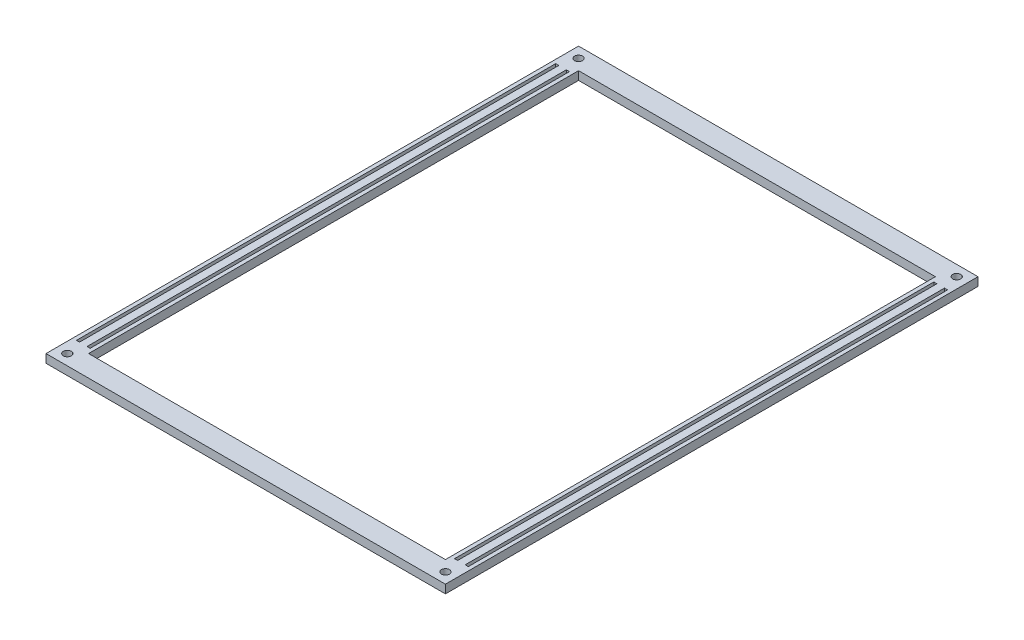
from build123d import *

# Parameters (mm, degrees)
SKETCH1_W          = 150
SKETCH1_H          = 200
SKETCH1_W_2        = 134
SKETCH1_H_2        = 184
MAINBODY_DEPTH     = 1.5875
SHEETLOCK_REACH    = 127.04
SKETCH2_W          = 1.17475
SKETCH2_H          = 180
SUPPORTHOLES_REACH = 127.04
SKETCH3_R          = 1.5


with BuildPart() as part:
    # Sketch1 → MainBody (new, symmetric)
    with BuildSketch(Plane(origin=(0, 0, 0), x_dir=(1, 0, 0), z_dir=(0, 1, 0))):
        Rectangle(SKETCH1_W, SKETCH1_H)
        Rectangle(SKETCH1_W_2, SKETCH1_H_2, mode=Mode.SUBTRACT)
    extrude(amount=MAINBODY_DEPTH, both=True)

    # Sketch2 → SheetLock (cut, up to next)
    with BuildSketch(Plane(origin=(0, 1.5875, 0), x_dir=(1, 0, 0), z_dir=(0, 1, 0)), mode=Mode.PRIVATE) as sheetlock_sk1:
        with Locations((-69, 0)):
            Rectangle(SKETCH2_W, SKETCH2_H)
    sheetlock_tool1 = extrude(sheetlock_sk1.sketch, amount=-SHEETLOCK_REACH, mode=Mode.PRIVATE) & part.part
    # Sketch2 → SheetLock (cut, up to next)
    with BuildSketch(Plane(origin=(0, 1.5875, 0), x_dir=(1, 0, 0), z_dir=(0, 1, 0)), mode=Mode.PRIVATE) as sheetlock_sk2:
        with Locations((-73, 0)):
            Rectangle(SKETCH2_W, SKETCH2_H)
    sheetlock_tool2 = extrude(sheetlock_sk2.sketch, amount=-SHEETLOCK_REACH, mode=Mode.PRIVATE) & part.part
    # Sketch2 → SheetLock (cut, up to next)
    with BuildSketch(Plane(origin=(0, 1.5875, 0), x_dir=(1, 0, 0), z_dir=(0, 1, 0)), mode=Mode.PRIVATE) as sheetlock_sk3:
        with Locations((69, 0)):
            Rectangle(SKETCH2_W, SKETCH2_H)
    sheetlock_tool3 = extrude(sheetlock_sk3.sketch, amount=-SHEETLOCK_REACH, mode=Mode.PRIVATE) & part.part
    # Sketch2 → SheetLock (cut, up to next)
    with BuildSketch(Plane(origin=(0, 1.5875, 0), x_dir=(1, 0, 0), z_dir=(0, 1, 0)), mode=Mode.PRIVATE) as sheetlock_sk4:
        with Locations((73, 0)):
            Rectangle(SKETCH2_W, SKETCH2_H)
    sheetlock_tool4 = extrude(sheetlock_sk4.sketch, amount=-SHEETLOCK_REACH, mode=Mode.PRIVATE) & part.part
    add(sheetlock_tool1.solids().sort_by_distance((-69, 1.5875, 0))[0], mode=Mode.SUBTRACT)
    add(sheetlock_tool2.solids().sort_by_distance((-73, 1.5875, 0))[0], mode=Mode.SUBTRACT)
    add(sheetlock_tool3.solids().sort_by_distance((69, 1.5875, 0))[0], mode=Mode.SUBTRACT)
    add(sheetlock_tool4.solids().sort_by_distance((73, 1.5875, 0))[0], mode=Mode.SUBTRACT)

    # Sketch3 → SupportHoles (cut, up to next)
    with BuildSketch(Plane(origin=(0, 1.5875, 0), x_dir=(1, 0, 0), z_dir=(0, 1, 0)), mode=Mode.PRIVATE) as supportholes_sk1:
        with Locations((-71, 96)):
            Circle(SKETCH3_R)
    supportholes_tool1 = extrude(supportholes_sk1.sketch, amount=-SUPPORTHOLES_REACH, mode=Mode.PRIVATE) & part.part
    # Sketch3 → SupportHoles (cut, up to next)
    with BuildSketch(Plane(origin=(0, 1.5875, 0), x_dir=(1, 0, 0), z_dir=(0, 1, 0)), mode=Mode.PRIVATE) as supportholes_sk2:
        with Locations((71, 96)):
            Circle(SKETCH3_R)
    supportholes_tool2 = extrude(supportholes_sk2.sketch, amount=-SUPPORTHOLES_REACH, mode=Mode.PRIVATE) & part.part
    # Sketch3 → SupportHoles (cut, up to next)
    with BuildSketch(Plane(origin=(0, 1.5875, 0), x_dir=(1, 0, 0), z_dir=(0, 1, 0)), mode=Mode.PRIVATE) as supportholes_sk3:
        with Locations((71, -96)):
            Circle(SKETCH3_R)
    supportholes_tool3 = extrude(supportholes_sk3.sketch, amount=-SUPPORTHOLES_REACH, mode=Mode.PRIVATE) & part.part
    # Sketch3 → SupportHoles (cut, up to next)
    with BuildSketch(Plane(origin=(0, 1.5875, 0), x_dir=(1, 0, 0), z_dir=(0, 1, 0)), mode=Mode.PRIVATE) as supportholes_sk4:
        with Locations((-71, -96)):
            Circle(SKETCH3_R)
    supportholes_tool4 = extrude(supportholes_sk4.sketch, amount=-SUPPORTHOLES_REACH, mode=Mode.PRIVATE) & part.part
    add(supportholes_tool1.solids().sort_by_distance((-71, 1.5875, -96))[0], mode=Mode.SUBTRACT)
    add(supportholes_tool2.solids().sort_by_distance((71, 1.5875, -96))[0], mode=Mode.SUBTRACT)
    add(supportholes_tool3.solids().sort_by_distance((71, 1.5875, 96))[0], mode=Mode.SUBTRACT)
    add(supportholes_tool4.solids().sort_by_distance((-71, 1.5875, 96))[0], mode=Mode.SUBTRACT)


solid = part.part
